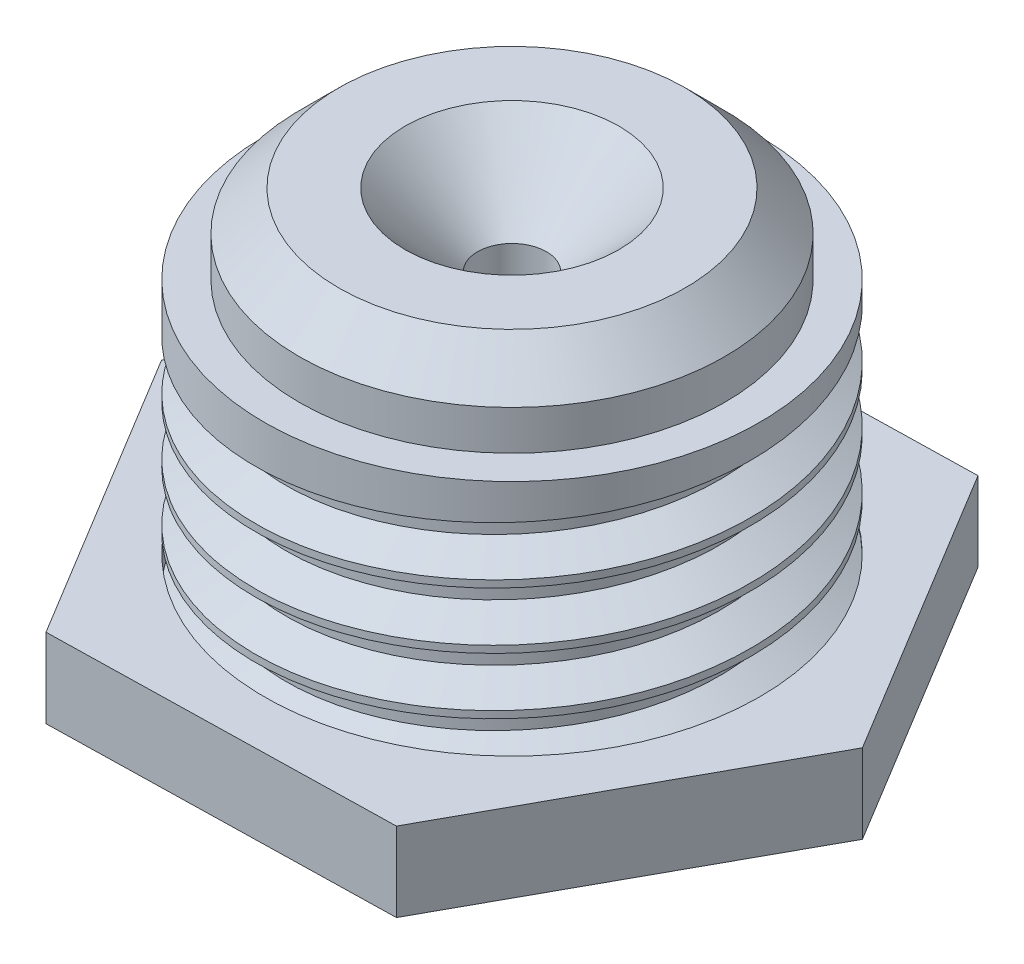
from build123d import *

# Parameters (mm, degrees)
BOSS_EXTRUDE2_DEPTH = 5.08
SKETCH2_R           = 2.2098
CUT_EXTRUDE2_DEPTH  = 36.861213071
CHAMFER2_SIZE       = 2.54
THREAD1_PITCH       = 3.628571429


with BuildPart() as part:
    # Sketch1 → Revolve1 (revolve)
    with BuildSketch(Plane.XY, mode=Mode.PRIVATE) as revolve1_sk:
        Polygon((-15.875, 15.24), (-13.64869, 15.24), (-13.64869, 20.32), (-6.858, 20.32), (-2.2098, 15.6718), (0, 15.6718), (0, 0), (-15.875, 0), align=None)
    revolve(revolve1_sk.sketch.rotate(Axis((0, 110.151211274, 0), (0, -1, 0)), 270), axis=Axis((0, 110.151211274, 0), (0, -1, 0)))

    # Sketch12 → Boss-Extrude2 (add)
    with BuildSketch(Plane.XZ):
        Polygon((-21.992027441, 0.469818106), (-11.402888135, -18.810745391), (10.589139305, -19.280563497), (21.992027441, -0.469818106), (11.402888135, 18.810745391), (-10.589139305, 19.280563497), align=None)
    extrude(amount=BOSS_EXTRUDE2_DEPTH)

    # Sketch2 → Cut-Extrude2 (cut, through all)
    with BuildSketch(Plane(origin=(0, 15.6718, 0), x_dir=(1, 0, 0), z_dir=(0, 1, 0))):
        with Locations(Location((0, 0, 0), (0, 0, 270))):
            Circle(SKETCH2_R)
    extrude(amount=-CUT_EXTRUDE2_DEPTH, mode=Mode.SUBTRACT)

    # Chamfer2
    chamfer2_edges = [part.edges().sort_by_distance(p)[0] for p in [
        (0, 20.32, -13.64869),
    ]]
    chamfer(chamfer2_edges, length=CHAMFER2_SIZE)

    # Thread1: the profile of Thread Profile1 profile screwed along a right-hand helix of 4.2 turns, 12 arcs to a turn; built about Z, then put on its axis
    thread1_z = Axis((0, 0, 0), (0, 0, 1))
    thread1_corners = [(15.8753, 0, -0.000173205), (15.8753, 0, 3.175173195), (13.910978111, 0, 2.041071424), (13.910978111, 0, 1.133928566)]
    with BuildLine(mode=Mode.PRIVATE) as thread1_profile:
        Line(thread1_corners[0], thread1_corners[1])
        Line(thread1_corners[1], thread1_corners[2])
        Line(thread1_corners[2], thread1_corners[3])
        Line(thread1_corners[3], thread1_corners[0])
    thread1_cap = Face(thread1_profile.wire())
    thread1_turn_angles = [0, 15, 30, 45, 60, 75, 90, 105, 120, 135, 150, 165, 180, 195, 210, 225, 240, 255, 270, 285, 300, 315, 330, 345, 360]
    thread1_turn_weights = [1, 0.9659258262890683, 1, 0.9659258262890683, 1, 0.9659258262890683, 1, 0.9659258262890683, 1, 0.9659258262890683, 1, 0.9659258262890683, 1, 0.9659258262890683, 1, 0.9659258262890683, 1, 0.9659258262890683, 1, 0.9659258262890683, 1, 0.9659258262890683, 1, 0.9659258262890683, 1]
    thread1_turn_rails = [Edge.make_bspline([Vector(p[0], p[1], 0).rotate(thread1_z, thread1_turn_angles[k]) / thread1_turn_weights[k] + Vector(0, 0, p[2] + THREAD1_PITCH * thread1_turn_angles[k] / 360) for k in range(25)], [0, 0, 0, 1, 1, 2, 2, 3, 3, 4, 4, 5, 5, 6, 6, 7, 7, 8, 8, 9, 9, 10, 10, 11, 11, 12, 12, 12], 2, thread1_turn_weights) for p in thread1_corners]
    thread1_turn_sides = [Face.make_surface_from_curves(thread1_turn_rails[p[0]], thread1_turn_rails[p[1]]) for p in [(0, 1), (1, 2), (2, 3), (3, 0)]]
    thread1_last_angles = [1440, 1455, 1470, 1485, 1500, 1506, 1512]
    thread1_last_weights = [1, 0.9659258262890683, 1, 0.9659258262890683, 1, 0.9945218953682727, 1]
    thread1_last_rails = [Edge.make_bspline([Vector(p[0], p[1], 0).rotate(thread1_z, thread1_last_angles[k]) / thread1_last_weights[k] + Vector(0, 0, p[2] + THREAD1_PITCH * thread1_last_angles[k] / 360) for k in range(7)], [0, 0, 0, 1, 1, 2, 2, 3, 3, 3], 2, thread1_last_weights) for p in thread1_corners]
    thread1_last_sides = [Face.make_surface_from_curves(thread1_last_rails[p[0]], thread1_last_rails[p[1]]) for p in [(0, 1), (1, 2), (2, 3), (3, 0)]]
    thread1 = Plane(origin=(0, 15.24, 0), x_dir=(-1, 0, 0), z_dir=(0, -1, 0)) * Solid(Shell([*[p.moved(Location((0, 0, THREAD1_PITCH * i))) for i in range(4) for p in thread1_turn_sides], *thread1_last_sides, thread1_cap, thread1_cap.rotate(thread1_z, 1512).moved(Location((0, 0, THREAD1_PITCH * 1512 / 360)))]))
    add(thread1, mode=Mode.SUBTRACT)


solid = part.part
